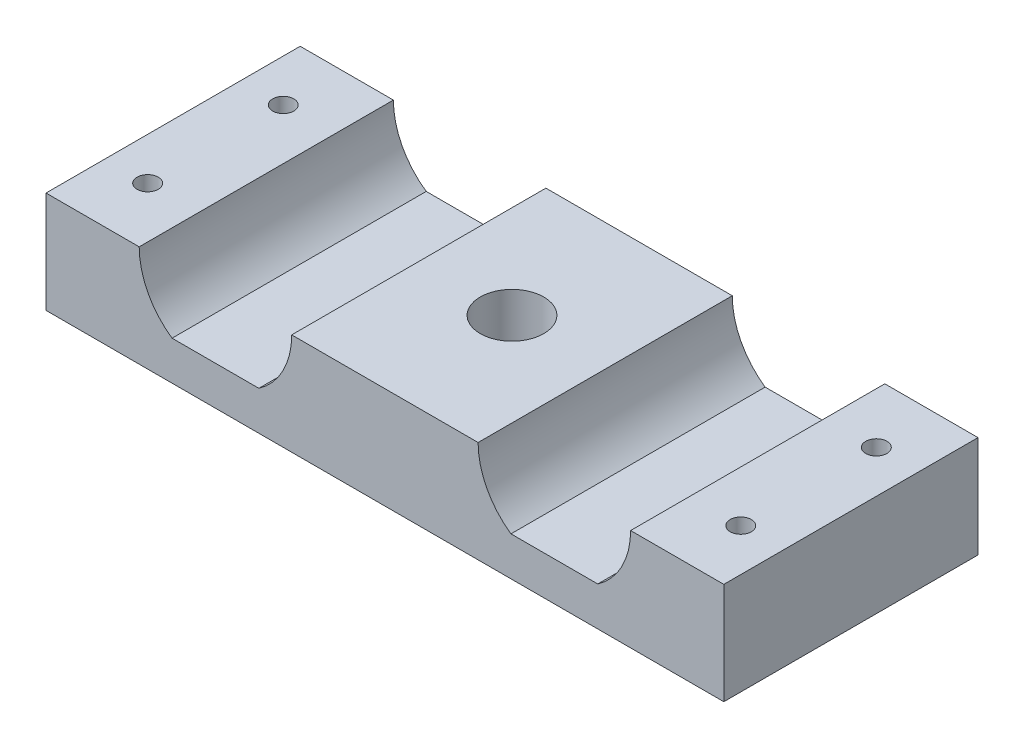
from build123d import *

# Parameters (mm, degrees)
BOSS_EXTRUDE1_DEPTH  = 38.1
HOLE1_D              = 9.525
HOLE1_DEPTH          = 101.6
HOLE2_D              = 3.175
HOLE2_DEPTH          = 101.6
LPATTERN1_COUNT      = 2
LPATTERN1_PITCH      = 20.32
LPATTERN1_COUNT_DIR2 = 2
LPATTERN1_PITCH_DIR2 = 88.9


with BuildPart() as part:
    # Sketch1 → Boss-Extrude1 (new body)
    with BuildSketch(Plane.XY):
        with BuildLine():
            Line((-50.8, 0), (50.8, 0))
            Line((50.8, 0), (50.8, 15.24))
            Line((50.8, 15.24), (36.83, 15.24))
            ThreePointArc((36.83, 15.24), (35.524317592, 9.934993562), (31.905574225, 5.842))
            Line((31.905574225, 5.842), (18.894425775, 5.842))
            ThreePointArc((18.894425775, 5.842), (15.275682408, 9.934993562), (13.97, 15.24))
            Line((13.97, 15.24), (-13.97, 15.24))
            ThreePointArc((-13.97, 15.24), (-15.275682408, 9.934993562), (-18.894425775, 5.842))
            Line((-18.894425775, 5.842), (-31.905574225, 5.842))
            ThreePointArc((-31.905574225, 5.842), (-35.524317592, 9.934993562), (-36.83, 15.24))
            Line((-36.83, 15.24), (-50.8, 15.24))
            Line((-50.8, 15.24), (-50.8, 0))
        make_face()
    extrude(amount=BOSS_EXTRUDE1_DEPTH)

    # Hole1
    with Locations(Plane(origin=(0, 15.24, 0), x_dir=(1, 0, 0), z_dir=(0, 1, 0))):
        with Locations((0, -19.05)):
            Hole(HOLE1_D / 2, depth=HOLE1_DEPTH)

    # Hole2
    with Locations(Plane(origin=(0, 15.24, 0), x_dir=(1, 0, 0), z_dir=(0, 1, 0))):
        with Locations((-44.45, -8.89)):
            hole2 = Hole(HOLE2_D / 2, depth=HOLE2_DEPTH)

    # LPattern1: Hole2 2 × 2
    with Locations(*[(j * LPATTERN1_PITCH_DIR2, 0, i * LPATTERN1_PITCH) for i in range(LPATTERN1_COUNT) for j in range(LPATTERN1_COUNT_DIR2) if (i, j) != (0, 0)]):
        add(hole2, mode=Mode.SUBTRACT)


solid = part.part
